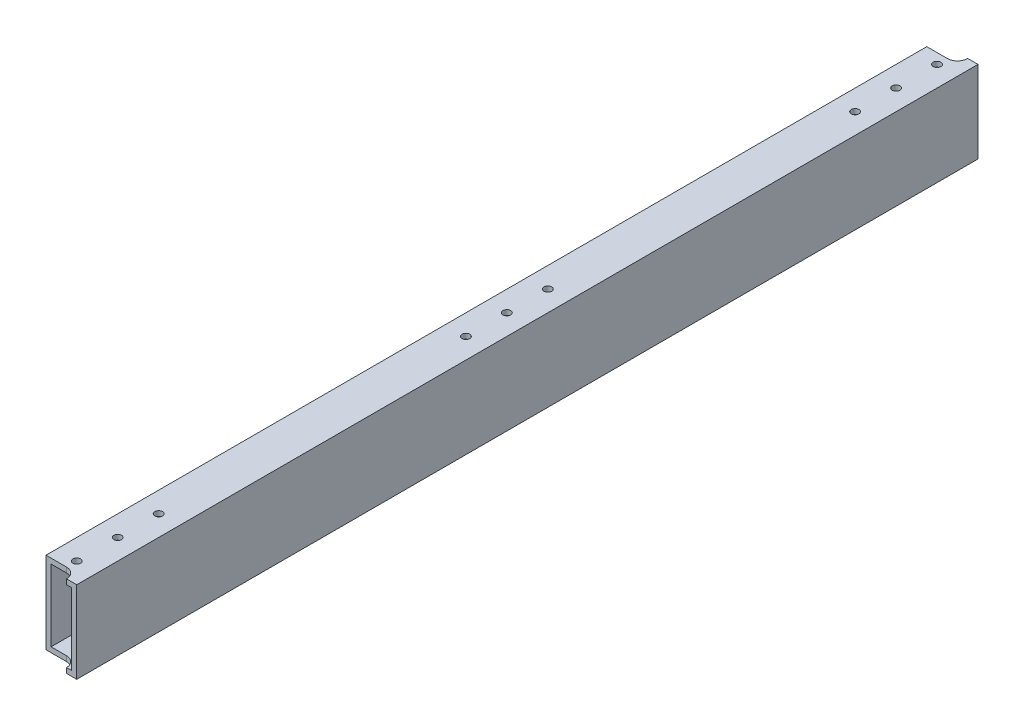
from build123d import *

# Parameters (mm, degrees)
SKETCH1_W           = 25.4
SKETCH1_H           = 50.8
BOSS_EXTRUDE1_DEPTH = 279.4
SHELL1_T            = -3.175
SKETCH3_R           = 2.38125
CUT_EXTRUDE1_DEPTH  = 285.264471927


with BuildPart() as part:
    # Sketch1 → Boss-Extrude1 (new, symmetric)
    with BuildSketch(Plane.XY):
        Rectangle(SKETCH1_W, SKETCH1_H)
    extrude(amount=BOSS_EXTRUDE1_DEPTH, both=True)

    # Shell1
    shell1_openings = [part.faces().sort_by_distance(p)[0] for p in [
        (0, 0, -279.4),
        (0, 0, 279.4),
    ]]
    offset(amount=SHELL1_T, openings=shell1_openings, kind=Kind.INTERSECTION)

    # Sketch3 → Cut-Extrude1 (cut, through all)
    with BuildSketch(Plane(origin=(0, 25.4, 0), x_dir=(1, 0, 0), z_dir=(0, 1, 0))):
        with Locations((0, 266.7)):
            Circle(SKETCH3_R)
        with Locations((0, 241.3)):
            Circle(SKETCH3_R)
        with Locations((0, 215.9)):
            Circle(SKETCH3_R)
        with Locations((0, -215.9)):
            Circle(SKETCH3_R)
        with Locations((0, -241.3)):
            Circle(SKETCH3_R)
        with Locations((0, -266.7)):
            Circle(SKETCH3_R)
        Circle(SKETCH3_R)
        with Locations((0, -25.4)):
            Circle(SKETCH3_R)
        with Locations((0, 25.4)):
            Circle(SKETCH3_R)
        with BuildLine():
            Line((6.35, 279.4), (-12.7, 279.4))
            Line((-12.7, 279.4), (-12.7, 273.05))
            Line((-12.7, 273.05), (0, 273.05))
            ThreePointArc((0, 273.05), (4.490128061, 274.909871939), (6.35, 279.4))
        make_face()
        with BuildLine():
            Line((-12.7, -273.05), (0, -273.05))
            ThreePointArc((0, -273.05), (4.490128061, -274.909871939), (6.35, -279.4))
            Line((6.35, -279.4), (-12.7, -279.4))
            Line((-12.7, -279.4), (-12.7, -273.05))
        make_face()
    extrude(amount=-CUT_EXTRUDE1_DEPTH, mode=Mode.SUBTRACT)


solid = part.part
